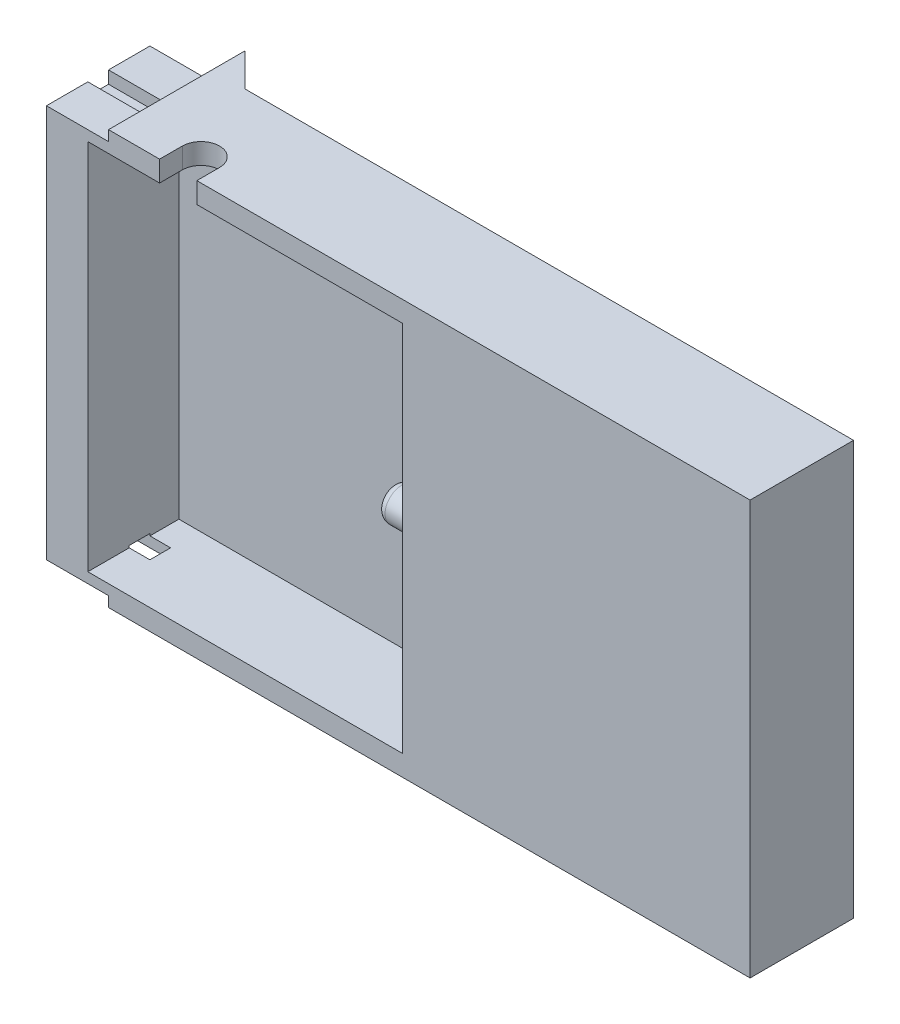
from build123d import *

# Parameters (mm, degrees)
SKETCH1_W                = 170
SKETCH1_H                = 100
BOSS_EXTRUDE1_DEPTH      = 15
SKETCH2_W                = 70
SKETCH2_H                = 70
CUT_EXTRUDE1_DEPTH       = 13
SKETCH3_W                = 70
SKETCH3_H                = 90
CUT_EXTRUDE2_DEPTH       = 12
SKETCH8_W                = 15
SKETCH8_H                = 15
CUT_EXTRUDE9_DEPTH       = 2.5
SKETCH9_W                = 15
SKETCH9_H                = 15
CUT_EXTRUDE10_DEPTH      = 2.5
SKETCH10_W               = 12
SKETCH10_H               = 90
CUT_EXTRUDE11_DEPTH      = 10
SKETCH11_W               = 80
SKETCH11_H               = 90
BOSS_EXTRUDE2_DEPTH      = 10
SKETCH12_W               = 22
SKETCH12_H               = 90
BOSS_EXTRUDE4_DEPTH      = 4
SKETCH2_2_W              = 70
SKETCH2_2_H              = 70
CUT_EXTRUDE12_DEPTH      = 22
SKETCH13_W               = 74
SKETCH13_H               = 74
SKETCH13_W_2             = 70
SKETCH13_H_2             = 70
CUT_EXTRUDE13_DEPTH      = 4
BOSS_EXTRUDE6_DEPTH      = 100
SKETCH15_W               = 5
SKETCH15_H               = 3
CUT_EXTRUDE14_DEPTH      = 15
SKETCH16_R               = 4
SKETCH16_R_2             = 3
BOSS_EXTRUDE7_DEPTH      = 15
SKETCH16_3_R             = 3
CUT_EXTRUDE15_DEPTH      = 15
FILLET1_R                = 2
CUT_EXTRUDE16_DEPTH      = 145.387791679
CUT_EXTRUDE16_DEPTH_BACK = 15


with BuildPart() as part:
    # Sketch1 → Boss-Extrude1 (new body)
    with BuildSketch(Plane.XY):
        with Locations((-16.108033241, 2.077562327)):
            Rectangle(SKETCH1_W, SKETCH1_H)
    extrude(amount=BOSS_EXTRUDE1_DEPTH)

    # Sketch2 → Cut-Extrude1 (cut)
    with BuildSketch(Plane(origin=(0, 0, 0), x_dir=(-1, 0, 0), z_dir=(0, 0, -1))):
        with Locations((-23.891966759, 2.077562327)):
            Rectangle(SKETCH2_W, SKETCH2_H)
    extrude(amount=-CUT_EXTRUDE1_DEPTH, mode=Mode.SUBTRACT)

    # Sketch3 → Cut-Extrude2 (cut)
    with BuildSketch(Plane.XY.offset(15)):
        with Locations((-56.108033241, 2.077562327)):
            Rectangle(SKETCH3_W, SKETCH3_H)
    extrude(amount=-CUT_EXTRUDE2_DEPTH, mode=Mode.SUBTRACT)

    # Sketch8 → Cut-Extrude9 (cut)
    with BuildSketch(Plane(origin=(0, 52.077562327, 0), x_dir=(1, 0, 0), z_dir=(0, 1, 0))):
        with Locations((-93.608033241, -7.5)):
            Rectangle(SKETCH8_W, SKETCH8_H)
    extrude(amount=-CUT_EXTRUDE9_DEPTH, mode=Mode.SUBTRACT)

    # Sketch9 → Cut-Extrude10 (cut)
    with BuildSketch(Plane.XZ.offset(47.922437673)):
        with Locations((-93.608033241, 7.5)):
            Rectangle(SKETCH9_W, SKETCH9_H)
    extrude(amount=-CUT_EXTRUDE10_DEPTH, mode=Mode.SUBTRACT)

    # Sketch10 → Cut-Extrude11 (cut)
    with BuildSketch(Plane.ZY.offset(21.108033241)):
        with Locations((9, 2.077562327)):
            Rectangle(SKETCH10_W, SKETCH10_H)
    extrude(amount=-CUT_EXTRUDE11_DEPTH, mode=Mode.SUBTRACT)

    # Sketch11 → Boss-Extrude2 (add)
    with BuildSketch(Plane.XY.offset(15)):
        Polygon((-86.108033241, -45.422437673), (-86.108033241, -47.922437673), (68.891966759, -47.922437673), (68.891966759, 52.077562327), (-86.108033241, 52.077562327), (-86.108033241, 49.577562327), (-101.108033241, 49.577562327), (-101.108033241, -45.422437673), align=None)
        with Locations((-51.108033241, 2.077562327)):
            Rectangle(SKETCH11_W, SKETCH11_H, mode=Mode.SUBTRACT)
    extrude(amount=BOSS_EXTRUDE2_DEPTH)

    # Sketch12 → Boss-Extrude4 (add)
    with BuildSketch(Plane.ZY.offset(11.108033241)):
        with Locations((14, 2.077562327)):
            Rectangle(SKETCH12_W, SKETCH12_H)
    extrude(amount=BOSS_EXTRUDE4_DEPTH)

    # Sketch2<2> → Cut-Extrude12 (cut)
    with BuildSketch(Plane(origin=(0, 0, 0), x_dir=(-1, 0, 0), z_dir=(0, 0, -1))):
        with Locations((-23.891966759, 2.077562327)):
            Rectangle(SKETCH2_2_W, SKETCH2_2_H)
    extrude(amount=-CUT_EXTRUDE12_DEPTH, mode=Mode.SUBTRACT)

    # Sketch13 → Cut-Extrude13 (cut)
    with BuildSketch(Plane(origin=(0, 0, 0), x_dir=(-1, 0, 0), z_dir=(0, 0, -1))):
        with Locations((-23.891966759, 2.077562327)):
            Rectangle(SKETCH13_W, SKETCH13_H)
        with Locations((-23.891966759, 2.077562327)):
            Rectangle(SKETCH13_W_2, SKETCH13_H_2, mode=Mode.SUBTRACT)
    extrude(amount=-CUT_EXTRUDE13_DEPTH, mode=Mode.SUBTRACT)

    # Sketch14 → Boss-Extrude6 (add)
    with BuildSketch(Plane(origin=(0, 52.077562327, 0), x_dir=(1, 0, 0), z_dir=(0, 1, 0))):
        Polygon((-86.108033241, 0), (-78.108033241, 0), (-86.108033241, 8), align=None)
    extrude(amount=-BOSS_EXTRUDE6_DEPTH)

    # Sketch15 → Cut-Extrude14 (cut)
    with BuildSketch(Plane.ZY.offset(101.108033241)):
        with Locations((12.5, 48.077562327)):
            Rectangle(SKETCH15_W, SKETCH15_H)
        with Locations((12.5, -43.922437673)):
            Rectangle(SKETCH15_W, SKETCH15_H)
    extrude(amount=-CUT_EXTRUDE14_DEPTH, mode=Mode.SUBTRACT)

    # Sketch16 → Boss-Extrude7 (add)
    with BuildSketch(Plane(origin=(-11.108033241, 0, 0), x_dir=(0, 0, -1), z_dir=(1, 0, 0))):
        with Locations(Location((-15.920102605, 0, 0), (0, 0, 90))):
            Circle(SKETCH16_R)
        with Locations(Location((-15.920102605, 0, 0), (0, 0, 90))):
            Circle(SKETCH16_R_2, mode=Mode.SUBTRACT)
    extrude(amount=-BOSS_EXTRUDE7_DEPTH)

    # Sketch16<3> → Cut-Extrude15 (cut)
    with BuildSketch(Plane(origin=(-11.108033241, 0, 0), x_dir=(0, 0, -1), z_dir=(1, 0, 0))):
        with Locations(Location((-15.920102605, 0, 0), (0, 0, 90))):
            Circle(SKETCH16_3_R)
    extrude(amount=-CUT_EXTRUDE15_DEPTH, mode=Mode.SUBTRACT)

    # Fillet1
    # the kernel refuses this fillet: 2 mm, written as the material it takes off along each edge
    with BuildSketch(Plane(origin=(-26.108033241, 0, 15.920102605), x_dir=(0, 1, 0), z_dir=(0, 0, -1))) as fillet1_piece_1:
        with BuildLine():
            CenterArc((2, 1.732050808), FILLET1_R, 300, 60)
            Line((3, 0), (3.02, -0.034641016))
            ThreePointArc((3.02, -0.034641016), (3.5, -0.04), (4, -0.04))
            Line((4, -0.04), (4.04, 0))
            Line((4.04, 0), (4.04, 1.732050808))
            Line((4.04, 1.732050808), (4, 1.732050808))
        make_face()
    revolve(axis=Axis((-26.108033241, 0, 15.920102605), (1, 0, 0)), mode=Mode.SUBTRACT)

    # Sketch17 → Cut-Extrude16 (cut, two sides: drawn at the far end of the back side and taken through both)
    with BuildSketch(Plane(origin=(0, 52.077562327, 0), x_dir=(1, 0, 0), z_dir=(0, 1, 0)).offset(-CUT_EXTRUDE16_DEPTH_BACK)):
        with BuildLine():
            Line((-64.771644572, -25), (-64.771644572, -19.506214928))
            ThreePointArc((-64.771644572, -19.506214928), (-69.270802051, -15.007057449), (-73.76995953, -19.506214928))
            Line((-73.76995953, -19.506214928), (-73.76995953, -25))
            Line((-73.76995953, -25), (-64.771644572, -25))
        make_face()
    extrude(amount=CUT_EXTRUDE16_DEPTH + CUT_EXTRUDE16_DEPTH_BACK, mode=Mode.SUBTRACT)


solid = part.part
